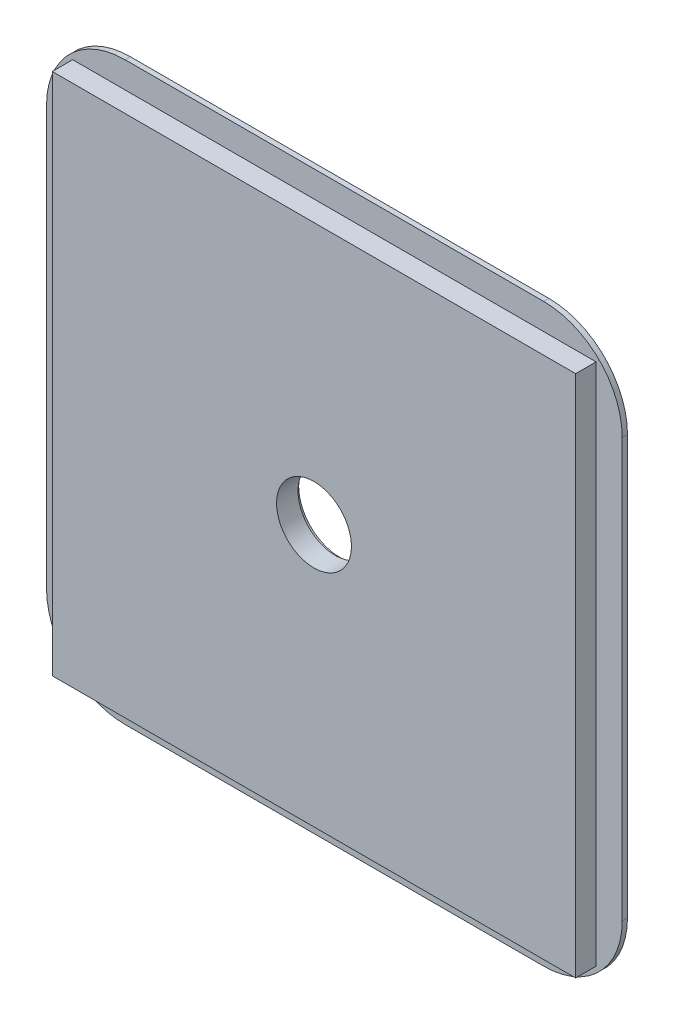
from build123d import *

# Parameters (mm, degrees)
SKETCH_1_W          = 100
SKETCH_1_H          = 100
EXTRUDE_1_DEPTH     = 3.9
SKETCH_2_W          = 110
SKETCH_2_H          = 110
EXTRUDE_2_DEPTH     = 1
SKETCH_3_R          = 7.15
CUT_EXTRUDE_1_DEPTH = 78.935935229
SKETCH_5_R          = 7.825
CUT_EXTRUDE_2_DEPTH = 0.8
FILLET_1_R          = 15


with BuildPart() as part:
    # 草图1 → 凸台-拉伸1 (new body)
    with BuildSketch(Plane.XY):
        Rectangle(SKETCH_1_W, SKETCH_1_H)
    extrude(amount=EXTRUDE_1_DEPTH)

    # 草图2 → 凸台-拉伸2 (add)
    with BuildSketch(Plane(origin=(0, 0, 0), x_dir=(-1, 0, 0), z_dir=(0, 0, -1))):
        Rectangle(SKETCH_2_W, SKETCH_2_H)
    extrude(amount=EXTRUDE_2_DEPTH)

    # 草图3 → 切除-拉伸1 (cut, through all)
    with BuildSketch(Plane(origin=(0, 0, -1), x_dir=(-1, 0, 0), z_dir=(0, 0, -1))):
        Circle(SKETCH_3_R)
    extrude(amount=-CUT_EXTRUDE_1_DEPTH, mode=Mode.SUBTRACT)

    # 草图5 → 切除-拉伸2 (cut)
    with BuildSketch(Plane(origin=(0, 0, -1), x_dir=(-1, 0, 0), z_dir=(0, 0, -1))):
        Circle(SKETCH_5_R)
    extrude(amount=-CUT_EXTRUDE_2_DEPTH, mode=Mode.SUBTRACT)

    # 圆角1
    fillet_1_edges = [part.edges().sort_by_distance(p)[0] for p in [
        (-55, -55, -0.5),
        (-55, 55, -0.5),
        (55, 55, -0.5),
        (55, -55, -0.5),
    ]]
    fillet(fillet_1_edges, radius=FILLET_1_R)


solid = part.part
